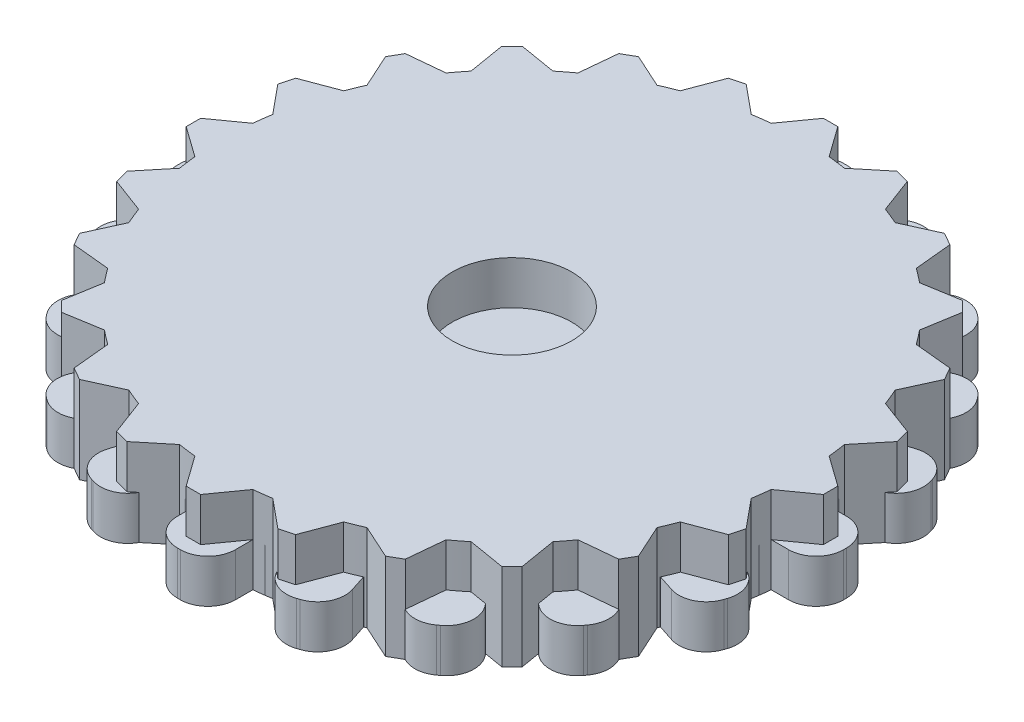
from build123d import *

# Parameters (mm, degrees)
BOSS_EXTRUDE3_DEPTH = 3
BOSS_EXTRUDE5_DEPTH = 6
BOSS_EXTRUDE6_DEPTH = 3
SKETCH4_R           = 4.125
CUT_EXTRUDE1_DEPTH  = 10


with BuildPart() as part:
    # Sketch2 → Boss-Extrude3 (new body)
    with BuildSketch(Plane(origin=(0, 0, 0), x_dir=(1, 0, 0), z_dir=(0, 1, 0))):
        with BuildLine():
            Line((-23, 0.1), (-23, -0.1))
            ThreePointArc((-23, -0.1), (-22.443502884, -1.443502884), (-21.1, -2))
            Line((-21.1, -2), (-19.899748742, -2))
            ThreePointArc((-19.899748742, -2), (-19.753766812, -3.128689301), (-19.543819703, -4.247247513))
            Line((-19.543819703, -4.247247513), (-20.685326483, -4.618145549))
            ThreePointArc((-20.685326483, -4.618145549), (-21.791106589, -5.56257098), (-21.905201574, -7.012285219))
            Line((-21.905201574, -7.012285219), (-21.843398175, -7.202496522))
            ThreePointArc((-21.843398175, -7.202496522), (-20.898972744, -8.308276629), (-19.449258505, -8.422371614))
            Line((-19.449258505, -8.422371614), (-18.307751725, -8.051473578))
            ThreePointArc((-18.307751725, -8.051473578), (-17.820130484, -9.079809995), (-17.274805421, -10.078744846))
            Line((-17.274805421, -10.078744846), (-18.245829086, -10.784234835))
            ThreePointArc((-18.245829086, -10.784234835), (-19.005644954, -12.02414164), (-18.666169396, -13.438159103))
            Line((-18.666169396, -13.438159103), (-18.548612345, -13.599962502))
            ThreePointArc((-18.548612345, -13.599962502), (-17.30870554, -14.35977837), (-15.894688077, -14.020302812))
            Line((-15.894688077, -14.020302812), (-14.923664412, -13.314812824))
            ThreePointArc((-14.923664412, -13.314812824), (-14.142135624, -14.142135624), (-13.314812824, -14.923664412))
            Line((-13.314812824, -14.923664412), (-14.020302812, -15.894688077))
            ThreePointArc((-14.020302812, -15.894688077), (-14.35977837, -17.30870554), (-13.599962502, -18.548612345))
            Line((-13.599962502, -18.548612345), (-13.438159103, -18.666169396))
            ThreePointArc((-13.438159103, -18.666169396), (-12.02414164, -19.005644954), (-10.784234835, -18.245829086))
            Line((-10.784234835, -18.245829086), (-10.078744846, -17.274805421))
            ThreePointArc((-10.078744846, -17.274805421), (-9.079809995, -17.820130484), (-8.051473578, -18.307751725))
            Line((-8.051473578, -18.307751725), (-8.422371614, -19.449258505))
            ThreePointArc((-8.422371614, -19.449258505), (-8.308276629, -20.898972744), (-7.202496522, -21.843398175))
            Line((-7.202496522, -21.843398175), (-7.012285219, -21.905201574))
            ThreePointArc((-7.012285219, -21.905201574), (-5.56257098, -21.791106589), (-4.618145549, -20.685326483))
            Line((-4.618145549, -20.685326483), (-4.247247513, -19.543819703))
            ThreePointArc((-4.247247513, -19.543819703), (-3.128689301, -19.753766812), (-2, -19.899748742))
            Line((-2, -19.899748742), (-2, -21.1))
            ThreePointArc((-2, -21.1), (-1.443502884, -22.443502884), (-0.1, -23))
            Line((-0.1, -23), (0.1, -23))
            ThreePointArc((0.1, -23), (1.443502884, -22.443502884), (2, -21.1))
            Line((2, -21.1), (2, -19.899748742))
            ThreePointArc((2, -19.899748742), (3.128689301, -19.753766812), (4.247247513, -19.543819703))
            Line((4.247247513, -19.543819703), (4.618145549, -20.685326483))
            ThreePointArc((4.618145549, -20.685326483), (5.56257098, -21.791106589), (7.012285219, -21.905201574))
            Line((7.012285219, -21.905201574), (7.202496522, -21.843398175))
            ThreePointArc((7.202496522, -21.843398175), (8.308276629, -20.898972744), (8.422371614, -19.449258505))
            Line((8.422371614, -19.449258505), (8.051473578, -18.307751725))
            ThreePointArc((8.051473578, -18.307751725), (9.079809995, -17.820130484), (10.078744846, -17.274805421))
            Line((10.078744846, -17.274805421), (10.784234835, -18.245829086))
            ThreePointArc((10.784234835, -18.245829086), (12.02414164, -19.005644954), (13.438159103, -18.666169396))
            Line((13.438159103, -18.666169396), (13.599962502, -18.548612345))
            ThreePointArc((13.599962502, -18.548612345), (14.35977837, -17.30870554), (14.020302812, -15.894688077))
            Line((14.020302812, -15.894688077), (13.314812824, -14.923664412))
            ThreePointArc((13.314812824, -14.923664412), (14.142135624, -14.142135624), (14.923664412, -13.314812824))
            Line((14.923664412, -13.314812824), (15.894688077, -14.020302812))
            ThreePointArc((15.894688077, -14.020302812), (17.30870554, -14.35977837), (18.548612345, -13.599962502))
            Line((18.548612345, -13.599962502), (18.666169396, -13.438159103))
            ThreePointArc((18.666169396, -13.438159103), (19.005644954, -12.02414164), (18.245829086, -10.784234835))
            Line((18.245829086, -10.784234835), (17.274805421, -10.078744846))
            ThreePointArc((17.274805421, -10.078744846), (17.820130484, -9.079809995), (18.307751725, -8.051473578))
            Line((18.307751725, -8.051473578), (19.449258505, -8.422371614))
            ThreePointArc((19.449258505, -8.422371614), (20.898972744, -8.308276629), (21.843398175, -7.202496522))
            Line((21.843398175, -7.202496522), (21.905201574, -7.012285219))
            ThreePointArc((21.905201574, -7.012285219), (21.791106589, -5.56257098), (20.685326483, -4.618145549))
            Line((20.685326483, -4.618145549), (19.543819703, -4.247247513))
            ThreePointArc((19.543819703, -4.247247513), (19.753766812, -3.128689301), (19.899748742, -2))
            Line((19.899748742, -2), (21.1, -2))
            ThreePointArc((21.1, -2), (22.443502884, -1.443502884), (23, -0.1))
            Line((23, -0.1), (23, 0.1))
            ThreePointArc((23, 0.1), (22.443502884, 1.443502884), (21.1, 2))
            Line((21.1, 2), (19.899748742, 2))
            ThreePointArc((19.899748742, 2), (19.753766812, 3.128689301), (19.543819703, 4.247247513))
            Line((19.543819703, 4.247247513), (20.685326483, 4.618145549))
            ThreePointArc((20.685326483, 4.618145549), (21.791106589, 5.56257098), (21.905201574, 7.012285219))
            Line((21.905201574, 7.012285219), (21.843398175, 7.202496522))
            ThreePointArc((21.843398175, 7.202496522), (20.898972744, 8.308276629), (19.449258505, 8.422371614))
            Line((19.449258505, 8.422371614), (18.307751725, 8.051473578))
            ThreePointArc((18.307751725, 8.051473578), (17.820130484, 9.079809995), (17.274805421, 10.078744846))
            Line((17.274805421, 10.078744846), (18.245829086, 10.784234835))
            ThreePointArc((18.245829086, 10.784234835), (19.005644954, 12.02414164), (18.666169396, 13.438159103))
            Line((18.666169396, 13.438159103), (18.548612345, 13.599962502))
            ThreePointArc((18.548612345, 13.599962502), (17.30870554, 14.35977837), (15.894688077, 14.020302812))
            Line((15.894688077, 14.020302812), (14.923664412, 13.314812824))
            ThreePointArc((14.923664412, 13.314812824), (14.142135624, 14.142135624), (13.314812824, 14.923664412))
            Line((13.314812824, 14.923664412), (14.020302812, 15.894688077))
            ThreePointArc((14.020302812, 15.894688077), (14.35977837, 17.30870554), (13.599962502, 18.548612345))
            Line((13.599962502, 18.548612345), (13.438159103, 18.666169396))
            ThreePointArc((13.438159103, 18.666169396), (12.02414164, 19.005644954), (10.784234835, 18.245829086))
            Line((10.784234835, 18.245829086), (10.078744846, 17.274805421))
            ThreePointArc((10.078744846, 17.274805421), (9.079809995, 17.820130484), (8.051473578, 18.307751725))
            Line((8.051473578, 18.307751725), (8.422371614, 19.449258505))
            ThreePointArc((8.422371614, 19.449258505), (8.308276629, 20.898972744), (7.202496522, 21.843398175))
            Line((7.202496522, 21.843398175), (7.012285219, 21.905201574))
            ThreePointArc((7.012285219, 21.905201574), (5.56257098, 21.791106589), (4.618145549, 20.685326483))
            Line((4.618145549, 20.685326483), (4.247247513, 19.543819703))
            ThreePointArc((4.247247513, 19.543819703), (3.128689301, 19.753766812), (2, 19.899748742))
            Line((2, 19.899748742), (2, 21.1))
            ThreePointArc((2, 21.1), (1.443502884, 22.443502884), (0.1, 23))
            Line((0.1, 23), (-0.1, 23))
            ThreePointArc((-0.1, 23), (-1.443502884, 22.443502884), (-2, 21.1))
            Line((-2, 21.1), (-2, 19.899748742))
            ThreePointArc((-2, 19.899748742), (-3.128689301, 19.753766812), (-4.247247513, 19.543819703))
            Line((-4.247247513, 19.543819703), (-4.618145549, 20.685326483))
            ThreePointArc((-4.618145549, 20.685326483), (-5.56257098, 21.791106589), (-7.012285219, 21.905201574))
            Line((-7.012285219, 21.905201574), (-7.202496522, 21.843398175))
            ThreePointArc((-7.202496522, 21.843398175), (-8.308276629, 20.898972744), (-8.422371614, 19.449258505))
            Line((-8.422371614, 19.449258505), (-8.051473578, 18.307751725))
            ThreePointArc((-8.051473578, 18.307751725), (-9.079809995, 17.820130484), (-10.078744846, 17.274805421))
            Line((-10.078744846, 17.274805421), (-10.784234835, 18.245829086))
            ThreePointArc((-10.784234835, 18.245829086), (-12.02414164, 19.005644954), (-13.438159103, 18.666169396))
            Line((-13.438159103, 18.666169396), (-13.599962502, 18.548612345))
            ThreePointArc((-13.599962502, 18.548612345), (-14.35977837, 17.30870554), (-14.020302812, 15.894688077))
            Line((-14.020302812, 15.894688077), (-13.314812824, 14.923664412))
            ThreePointArc((-13.314812824, 14.923664412), (-14.142135624, 14.142135624), (-14.923664412, 13.314812824))
            Line((-14.923664412, 13.314812824), (-15.894688077, 14.020302812))
            ThreePointArc((-15.894688077, 14.020302812), (-17.30870554, 14.35977837), (-18.548612345, 13.599962502))
            Line((-18.548612345, 13.599962502), (-18.666169396, 13.438159103))
            ThreePointArc((-18.666169396, 13.438159103), (-19.005644954, 12.02414164), (-18.245829086, 10.784234835))
            Line((-18.245829086, 10.784234835), (-17.274805421, 10.078744846))
            ThreePointArc((-17.274805421, 10.078744846), (-17.820130484, 9.079809995), (-18.307751725, 8.051473578))
            Line((-18.307751725, 8.051473578), (-19.449258505, 8.422371614))
            ThreePointArc((-19.449258505, 8.422371614), (-20.898972744, 8.308276629), (-21.843398175, 7.202496522))
            Line((-21.843398175, 7.202496522), (-21.905201574, 7.012285219))
            ThreePointArc((-21.905201574, 7.012285219), (-21.791106589, 5.56257098), (-20.685326483, 4.618145549))
            Line((-20.685326483, 4.618145549), (-19.543819703, 4.247247513))
            ThreePointArc((-19.543819703, 4.247247513), (-19.753766812, 3.128689301), (-19.899748742, 2))
            Line((-19.899748742, 2), (-21.1, 2))
            ThreePointArc((-21.1, 2), (-22.443502884, 1.443502884), (-23, 0.1))
        make_face()
    extrude(amount=BOSS_EXTRUDE3_DEPTH)


with BuildPart() as body_2:
    # Sketch3 → Boss-Extrude5 (new body)
    with BuildSketch(Plane(origin=(0, 0, 0), x_dir=(1, 0, 0), z_dir=(0, 1, 0))):
        with BuildLine():
            Line((-22, 0.5), (-22, -0.5))
            Line((-22, -0.5), (-19.899748742, -2))
            ThreePointArc((-19.899748742, -2), (-19.828897227, -2.610523844), (-19.739319337, -3.218582315))
            Line((-19.739319337, -3.218582315), (-21.379777701, -5.211056079))
            Line((-21.379777701, -5.211056079), (-21.120958656, -6.176981905))
            Line((-21.120958656, -6.176981905), (-18.704043156, -7.08228562))
            ThreePointArc((-18.704043156, -7.08228562), (-18.47759065, -7.653668647), (-18.23368794, -8.217823563))
            Line((-18.23368794, -8.217823563), (-19.302558883, -10.566987298))
            Line((-19.302558883, -10.566987298), (-18.802558883, -11.433012702))
            Line((-18.802558883, -11.433012702), (-16.23368794, -11.681925179))
            ThreePointArc((-16.23368794, -11.681925179), (-15.867066806, -12.17522858), (-15.485460842, -12.657033717))
            Line((-15.485460842, -12.657033717), (-15.909902577, -15.202795796))
            Line((-15.909902577, -15.202795796), (-15.202795796, -15.909902577))
            Line((-15.202795796, -15.909902577), (-12.657033717, -15.485460842))
            ThreePointArc((-12.657033717, -15.485460842), (-12.17522858, -15.867066806), (-11.681925179, -16.23368794))
            Line((-11.681925179, -16.23368794), (-11.433012702, -18.802558883))
            Line((-11.433012702, -18.802558883), (-10.566987298, -19.302558883))
            Line((-10.566987298, -19.302558883), (-8.217823563, -18.23368794))
            ThreePointArc((-8.217823563, -18.23368794), (-7.653668647, -18.47759065), (-7.08228562, -18.704043156))
            Line((-7.08228562, -18.704043156), (-6.176981905, -21.120958656))
            Line((-6.176981905, -21.120958656), (-5.211056079, -21.379777701))
            Line((-5.211056079, -21.379777701), (-3.218582315, -19.739319337))
            ThreePointArc((-3.218582315, -19.739319337), (-2.610523844, -19.828897227), (-2, -19.899748742))
            Line((-2, -19.899748742), (-0.5, -22))
            Line((-0.5, -22), (0.5, -22))
            Line((0.5, -22), (2, -19.899748742))
            ThreePointArc((2, -19.899748742), (2.610523844, -19.828897227), (3.218582315, -19.739319337))
            Line((3.218582315, -19.739319337), (5.211056079, -21.379777701))
            Line((5.211056079, -21.379777701), (6.176981905, -21.120958656))
            Line((6.176981905, -21.120958656), (7.08228562, -18.704043156))
            ThreePointArc((7.08228562, -18.704043156), (7.653668647, -18.47759065), (8.217823563, -18.23368794))
            Line((8.217823563, -18.23368794), (10.566987298, -19.302558883))
            Line((10.566987298, -19.302558883), (11.433012702, -18.802558883))
            Line((11.433012702, -18.802558883), (11.681925179, -16.23368794))
            ThreePointArc((11.681925179, -16.23368794), (12.17522858, -15.867066806), (12.657033717, -15.485460842))
            Line((12.657033717, -15.485460842), (15.202795796, -15.909902577))
            Line((15.202795796, -15.909902577), (15.909902577, -15.202795796))
            Line((15.909902577, -15.202795796), (15.485460842, -12.657033717))
            ThreePointArc((15.485460842, -12.657033717), (15.867066806, -12.17522858), (16.23368794, -11.681925179))
            Line((16.23368794, -11.681925179), (18.802558883, -11.433012702))
            Line((18.802558883, -11.433012702), (19.302558883, -10.566987298))
            Line((19.302558883, -10.566987298), (18.23368794, -8.217823563))
            ThreePointArc((18.23368794, -8.217823563), (18.47759065, -7.653668647), (18.704043156, -7.08228562))
            Line((18.704043156, -7.08228562), (21.120958656, -6.176981905))
            Line((21.120958656, -6.176981905), (21.379777701, -5.211056079))
            Line((21.379777701, -5.211056079), (19.739319337, -3.218582315))
            ThreePointArc((19.739319337, -3.218582315), (19.828897227, -2.610523844), (19.899748742, -2))
            Line((19.899748742, -2), (22, -0.5))
            Line((22, -0.5), (22, 0.5))
            Line((22, 0.5), (19.899748742, 2))
            ThreePointArc((19.899748742, 2), (19.828897227, 2.610523844), (19.739319337, 3.218582315))
            Line((19.739319337, 3.218582315), (21.379777701, 5.211056079))
            Line((21.379777701, 5.211056079), (21.120958656, 6.176981905))
            Line((21.120958656, 6.176981905), (18.704043156, 7.08228562))
            ThreePointArc((18.704043156, 7.08228562), (18.47759065, 7.653668647), (18.23368794, 8.217823563))
            Line((18.23368794, 8.217823563), (19.302558883, 10.566987298))
            Line((19.302558883, 10.566987298), (18.802558883, 11.433012702))
            Line((18.802558883, 11.433012702), (16.23368794, 11.681925179))
            ThreePointArc((16.23368794, 11.681925179), (15.867066806, 12.17522858), (15.485460842, 12.657033717))
            Line((15.485460842, 12.657033717), (15.909902577, 15.202795796))
            Line((15.909902577, 15.202795796), (15.202795796, 15.909902577))
            Line((15.202795796, 15.909902577), (12.657033717, 15.485460842))
            ThreePointArc((12.657033717, 15.485460842), (12.17522858, 15.867066806), (11.681925179, 16.23368794))
            Line((11.681925179, 16.23368794), (11.433012702, 18.802558883))
            Line((11.433012702, 18.802558883), (10.566987298, 19.302558883))
            Line((10.566987298, 19.302558883), (8.217823563, 18.23368794))
            ThreePointArc((8.217823563, 18.23368794), (7.653668647, 18.47759065), (7.08228562, 18.704043156))
            Line((7.08228562, 18.704043156), (6.176981905, 21.120958656))
            Line((6.176981905, 21.120958656), (5.211056079, 21.379777701))
            Line((5.211056079, 21.379777701), (3.218582315, 19.739319337))
            ThreePointArc((3.218582315, 19.739319337), (2.610523844, 19.828897227), (2, 19.899748742))
            Line((2, 19.899748742), (0.5, 22))
            Line((0.5, 22), (-0.5, 22))
            Line((-0.5, 22), (-2, 19.899748742))
            ThreePointArc((-2, 19.899748742), (-2.610523844, 19.828897227), (-3.218582315, 19.739319337))
            Line((-3.218582315, 19.739319337), (-5.211056079, 21.379777701))
            Line((-5.211056079, 21.379777701), (-6.176981905, 21.120958656))
            Line((-6.176981905, 21.120958656), (-7.08228562, 18.704043156))
            ThreePointArc((-7.08228562, 18.704043156), (-7.653668647, 18.47759065), (-8.217823563, 18.23368794))
            Line((-8.217823563, 18.23368794), (-10.566987298, 19.302558883))
            Line((-10.566987298, 19.302558883), (-11.433012702, 18.802558883))
            Line((-11.433012702, 18.802558883), (-11.681925179, 16.23368794))
            ThreePointArc((-11.681925179, 16.23368794), (-12.17522858, 15.867066806), (-12.657033717, 15.485460842))
            Line((-12.657033717, 15.485460842), (-15.202795796, 15.909902577))
            Line((-15.202795796, 15.909902577), (-15.909902577, 15.202795796))
            Line((-15.909902577, 15.202795796), (-15.485460842, 12.657033717))
            ThreePointArc((-15.485460842, 12.657033717), (-15.867066806, 12.17522858), (-16.23368794, 11.681925179))
            Line((-16.23368794, 11.681925179), (-18.802558883, 11.433012702))
            Line((-18.802558883, 11.433012702), (-19.302558883, 10.566987298))
            Line((-19.302558883, 10.566987298), (-18.23368794, 8.217823563))
            ThreePointArc((-18.23368794, 8.217823563), (-18.47759065, 7.653668647), (-18.704043156, 7.08228562))
            Line((-18.704043156, 7.08228562), (-21.120958656, 6.176981905))
            Line((-21.120958656, 6.176981905), (-21.379777701, 5.211056079))
            Line((-21.379777701, 5.211056079), (-19.739319337, 3.218582315))
            ThreePointArc((-19.739319337, 3.218582315), (-19.828897227, 2.610523844), (-19.899748742, 2))
            Line((-19.899748742, 2), (-22, 0.5))
        make_face()
    extrude(amount=BOSS_EXTRUDE5_DEPTH)

    # Sketch4 → Cut-Extrude1 (cut)
    with BuildSketch(Plane(origin=(0, 6, 0), x_dir=(1, 0, 0), z_dir=(0, 1, 0))):
        Circle(SKETCH4_R)
    extrude(amount=-CUT_EXTRUDE1_DEPTH, mode=Mode.SUBTRACT)


with BuildPart() as body_3:
    # Sketch1 → Boss-Extrude6 (new body)
    with BuildSketch(Plane(origin=(0, 0, 0), x_dir=(1, 0, 0), z_dir=(0, 1, 0))):
        with BuildLine():
            Line((-0.5, 14.746169466), (0.5, 14.746169466))
            Line((0.5, 14.746169466), (2, 12.544128437))
            ThreePointArc((2, 12.544128437), (2.588190451, 12.405427729), (3.166928678, 12.23145084))
            Line((3.166928678, 12.23145084), (5.566987298, 13.388474311))
            Line((5.566987298, 13.388474311), (6.433012702, 12.888474311))
            Line((6.433012702, 12.888474311), (6.631030293, 10.23145084))
            ThreePointArc((6.631030293, 10.23145084), (7.071067812, 9.817237278), (7.485281374, 9.377199759))
            Line((7.485281374, 9.377199759), (10.142304845, 9.179182168))
            Line((10.142304845, 9.179182168), (10.642304845, 8.313156764))
            Line((10.642304845, 8.313156764), (9.485281374, 5.913098144))
            ThreePointArc((9.485281374, 5.913098144), (9.659258263, 5.334359917), (9.797958971, 4.746169466))
            Line((9.797958971, 4.746169466), (12, 3.246169466))
            Line((12, 3.246169466), (12, 2.246169466))
            Line((12, 2.246169466), (9.797958971, 0.746169466))
            ThreePointArc((9.797958971, 0.746169466), (9.659258263, 0.157979015), (9.485281374, -0.420759212))
            Line((9.485281374, -0.420759212), (10.642304845, -2.820817832))
            Line((10.642304845, -2.820817832), (10.142304845, -3.686843236))
            Line((10.142304845, -3.686843236), (7.485281374, -3.884860827))
            ThreePointArc((7.485281374, -3.884860827), (7.071067812, -4.324898346), (6.631030293, -4.739111908))
            Line((6.631030293, -4.739111908), (6.433012702, -7.39613538))
            Line((6.433012702, -7.39613538), (5.566987298, -7.89613538))
            Line((5.566987298, -7.89613538), (3.166928678, -6.739111908))
            ThreePointArc((3.166928678, -6.739111908), (2.588190451, -6.913088797), (2, -7.051789505))
            Line((2, -7.051789505), (0.5, -9.253830534))
            Line((0.5, -9.253830534), (-0.5, -9.253830534))
            Line((-0.5, -9.253830534), (-2, -7.051789505))
            ThreePointArc((-2, -7.051789505), (-2.588190451, -6.913088797), (-3.166928678, -6.739111908))
            Line((-3.166928678, -6.739111908), (-5.566987298, -7.89613538))
            Line((-5.566987298, -7.89613538), (-6.433012702, -7.39613538))
            Line((-6.433012702, -7.39613538), (-6.631030293, -4.739111908))
            ThreePointArc((-6.631030293, -4.739111908), (-7.071067812, -4.324898346), (-7.485281374, -3.884860827))
            Line((-7.485281374, -3.884860827), (-10.142304845, -3.686843236))
            Line((-10.142304845, -3.686843236), (-10.642304845, -2.820817832))
            Line((-10.642304845, -2.820817832), (-9.485281374, -0.420759212))
            ThreePointArc((-9.485281374, -0.420759212), (-9.659258263, 0.157979015), (-9.797958971, 0.746169466))
            Line((-9.797958971, 0.746169466), (-12, 2.246169466))
            Line((-12, 2.246169466), (-12, 3.246169466))
            Line((-12, 3.246169466), (-9.797958971, 4.746169466))
            ThreePointArc((-9.797958971, 4.746169466), (-9.659258263, 5.334359917), (-9.485281374, 5.913098144))
            Line((-9.485281374, 5.913098144), (-10.642304845, 8.313156764))
            Line((-10.642304845, 8.313156764), (-10.142304845, 9.179182168))
            Line((-10.142304845, 9.179182168), (-7.485281374, 9.377199759))
            ThreePointArc((-7.485281374, 9.377199759), (-7.071067812, 9.817237278), (-6.631030293, 10.23145084))
            Line((-6.631030293, 10.23145084), (-6.433012702, 12.888474311))
            Line((-6.433012702, 12.888474311), (-5.566987298, 13.388474311))
            Line((-5.566987298, 13.388474311), (-3.166928678, 12.23145084))
            ThreePointArc((-3.166928678, 12.23145084), (-2.588190451, 12.405427729), (-2, 12.544128437))
            Line((-2, 12.544128437), (-0.5, 14.746169466))
        make_face()
    extrude(amount=BOSS_EXTRUDE6_DEPTH)


solid = Compound([part.part, body_2.part, body_3.part])
